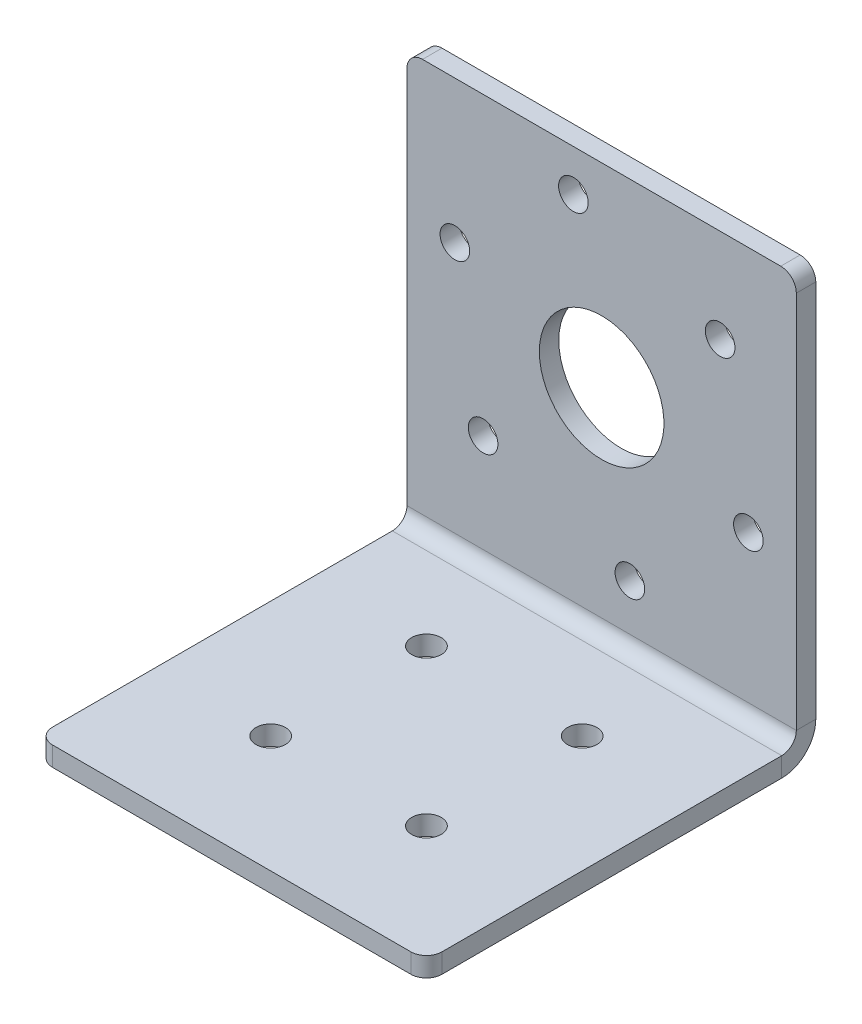
from build123d import *

# Parameters (mm, degrees)
SKETCH1_W              = 63.5
SKETCH1_H              = 63.5
SKETCH1_R              = 2.413
BOSS_EXTRUDE1_DEPTH    = 3.175
SKETCH2_W              = 63.5
SKETCH2_H              = 3.175
BOSS_EXTRUDE2_DEPTH    = 66.675
SKETCH3_R              = 10.16
SKETCH3_R_2            = 2.413
CUT_EXTRUDE2_DEPTH     = 60.325
FILLET1_R              = 2.54
CONVERT_SOLID1_DEPTH   = 63.5
CONVERT_SOLID1_2_DEPTH = 63.5


# Read off the part's stored shape, not the designer's step: Convert-Solid1
with BuildPart() as part:
    # Sketch1 → Boss-Extrude1 (new body)
    with BuildSketch(Plane(origin=(0, 0, 0), x_dir=(1, 0, 0), z_dir=(0, 1, 0))):
        with Locations((31.75, 31.75)):
            Rectangle(SKETCH1_W, SKETCH1_H)
        with Locations(Location((19.05, 44.45, 0), (0, 0, 270))):
            Circle(SKETCH1_R, mode=Mode.SUBTRACT)
        with Locations(Location((44.45, 44.45, 0), (0, 0, 270))):
            Circle(SKETCH1_R, mode=Mode.SUBTRACT)
        with Locations(Location((19.05, 19.05, 0), (0, 0, 270))):
            Circle(SKETCH1_R, mode=Mode.SUBTRACT)
        with Locations(Location((44.45, 19.05, 0), (0, 0, 270))):
            Circle(SKETCH1_R, mode=Mode.SUBTRACT)
    extrude(amount=BOSS_EXTRUDE1_DEPTH)

    # Sketch2 → Boss-Extrude2 (add)
    with BuildSketch(Plane(origin=(0, 3.175, 0), x_dir=(1, 0, 0), z_dir=(0, 1, 0))):
        with Locations((31.75, 61.9125)):
            Rectangle(SKETCH2_W, SKETCH2_H)
    extrude(amount=BOSS_EXTRUDE2_DEPTH)

    # Sketch3 → Cut-Extrude2 (cut)
    with BuildSketch(Plane(origin=(0, 0, -63.5), x_dir=(-1, 0, 0), z_dir=(0, 0, -1))):
        with Locations((-31.75, 38.1)):
            Circle(SKETCH3_R)
        with Locations((-27.144154857, 63.078914919)):
            Circle(SKETCH3_R_2)
        with Locations((-7.81470255, 46.600678559)):
            Circle(SKETCH3_R_2)
        with Locations((-12.420547693, 21.621763641)):
            Circle(SKETCH3_R_2)
        with Locations((-36.355845143, 13.121085081)):
            Circle(SKETCH3_R_2)
        with Locations((-55.68529745, 29.599321441)):
            Circle(SKETCH3_R_2)
        with Locations((-51.079452307, 54.578236359)):
            Circle(SKETCH3_R_2)
    extrude(amount=-CUT_EXTRUDE2_DEPTH, mode=Mode.SUBTRACT)

    # Fillet1
    fillet1_edges = [part.edges().sort_by_distance(p)[0] for p in [
        (0, 69.85, -61.9125),
        (63.5, 69.85, -61.9125),
        (63.5, 1.5875, 0),
        (0, 1.5875, 0),
    ]]
    fillet(fillet1_edges, radius=FILLET1_R)

    # Convert-Solid1 outline → Convert-Solid1 (cut)
    with BuildSketch(Plane.YZ):
        with BuildLine():
            Line((0, -63.5), (5.555000066, -63.5))
            ThreePointArc((5.555000066, -63.5), (1.62702185, -61.87297815), (0, -57.944999934))
            Line((0, -57.944999934), (0, -63.5))
        make_face()
    extrude(amount=CONVERT_SOLID1_DEPTH, mode=Mode.SUBTRACT)

    # Convert-Solid1 2 outline → Convert-Solid1 2 (add)
    with BuildSketch(Plane.YZ):
        with BuildLine():
            Line((3.175, -60.325), (5.555000066, -60.325))
            ThreePointArc((5.555000066, -60.325), (3.87208588, -59.62791412), (3.175, -57.944999934))
            Line((3.175, -57.944999934), (3.175, -60.325))
        make_face()
    extrude(amount=CONVERT_SOLID1_2_DEPTH)


solid = part.part
